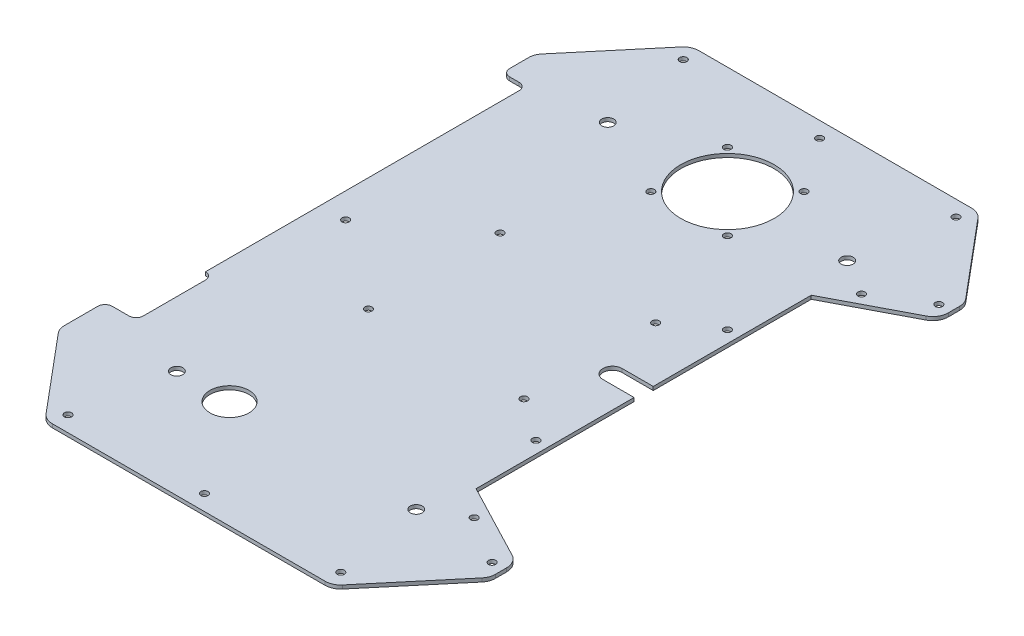
from build123d import *

# Parameters (mm, degrees)
BOSS_EXTRU_1_DEPTH           = 1.5
CHANFREIN1_SIZE              = 30
CHANFREIN1_SIZE2             = 35.752607778
ENL_V_MAT_EXTRU_1_REACH      = 164.257
ESQUISSE2_R                  = 2.5
ESQUISSE2_R_2                = 1.5
ESQUISSE5_R                  = 1.5
ENL_V_MAT_EXTRU_4_DEPTH      = 163.256741
CONG_2_R                     = 6.5
ESQUISSE3_R                  = 1.5
ENL_V_MAT_EXTRU_2_DEPTH      = 163.256741
ENL_V_MAT_EXTRU_3_DEPTH      = 163.256741
ENL_V_MAT_EXTRU_3_DEPTH_BACK = 163.256741
ESQUISSE4_R                  = 8.15
ESQUISSE4_R_2                = 19.5
ESQUISSE4_R_3                = 1.5
ENL_V_MAT_EXTRU_5_REACH      = 164.257
ESQUISSE6_W                  = 3
ESQUISSE6_H                  = 32
ESQUISSE6_R                  = 1.5
CONG_1_R                     = 3


with BuildPart() as part:
    # Esquisse1 → Boss.-Extru.1 (new body)
    with BuildSketch(Plane(origin=(0, 0, 0), x_dir=(1, 0, 0), z_dir=(0, 1, 0))):
        Polygon((-90, 135), (90, 135), (90, 88.309833424), (55, 70), (55, 0), (-90, 0), align=None)
    extrude(amount=BOSS_EXTRU_1_DEPTH)

    # Chanfrein1
    chanfrein1_edges = [part.edges().sort_by_distance(p)[0] for p in [
        (-90, 0.75, -135),
        (90, 0.75, -135),
    ]]
    chanfrein1_side = [part.faces().sort_by_distance(p)[0] for p in [
        (0, 0.75, -135),
    ]]
    chamfer(chanfrein1_edges, length=CHANFREIN1_SIZE, length2=CHANFREIN1_SIZE2, reference=chanfrein1_side[0])

    # Esquisse2 → Enlèv. mat.-Extru.1 (cut, up to next)
    with BuildSketch(Plane(origin=(0, 1.5, 0), x_dir=(1, 0, 0), z_dir=(0, 1, 0)), mode=Mode.PRIVATE) as enl_v_mat_extru_1_sk1:
        with Locations(Location((-50, 90, 0), (0, 0, 270))):
            Circle(ESQUISSE2_R)
    enl_v_mat_extru_1_tool1 = extrude(enl_v_mat_extru_1_sk1.sketch, amount=-ENL_V_MAT_EXTRU_1_REACH, mode=Mode.PRIVATE) & part.part
    # Esquisse2 → Enlèv. mat.-Extru.1 (cut, up to next)
    with BuildSketch(Plane(origin=(0, 1.5, 0), x_dir=(1, 0, 0), z_dir=(0, 1, 0)), mode=Mode.PRIVATE) as enl_v_mat_extru_1_sk2:
        with Locations(Location((50, 90, 0), (0, 0, 270))):
            Circle(ESQUISSE2_R)
    enl_v_mat_extru_1_tool2 = extrude(enl_v_mat_extru_1_sk2.sketch, amount=-ENL_V_MAT_EXTRU_1_REACH, mode=Mode.PRIVATE) & part.part
    # Esquisse2 → Enlèv. mat.-Extru.1 (cut, up to next)
    with BuildSketch(Plane(origin=(0, 1.5, 0), x_dir=(1, 0, 0), z_dir=(0, 1, 0)), mode=Mode.PRIVATE) as enl_v_mat_extru_1_sk3:
        with Locations(Location((50, 40, 0), (0, 0, 270))):
            Circle(ESQUISSE2_R_2)
    enl_v_mat_extru_1_tool3 = extrude(enl_v_mat_extru_1_sk3.sketch, amount=-ENL_V_MAT_EXTRU_1_REACH, mode=Mode.PRIVATE) & part.part
    add(enl_v_mat_extru_1_tool1.solids().sort_by_distance((-50, 1.5, -90))[0], mode=Mode.SUBTRACT)
    add(enl_v_mat_extru_1_tool2.solids().sort_by_distance((50, 1.5, -90))[0], mode=Mode.SUBTRACT)
    add(enl_v_mat_extru_1_tool3.solids().sort_by_distance((50, 1.5, -40))[0], mode=Mode.SUBTRACT)

    # Esquisse5 → Enlèv. mat.-Extru.4 (cut, through all)
    with BuildSketch(Plane(origin=(0, 1.5, 0), x_dir=(1, 0, 0), z_dir=(0, 1, 0))):
        with Locations(Location((85, 93.309833424, 0), (0, 0, 270))):
            Circle(ESQUISSE5_R)
        with Locations(Location((65.087362858, 80.91994096, 0), (0, 0, 270))):
            Circle(ESQUISSE5_R)
        with Locations(Location((-56.969000222, 128.5, 0), (0, 0, 270))):
            Circle(ESQUISSE5_R)
        with Locations(Location((0, 128.5, 0), (0, 0, 270))):
            Circle(ESQUISSE5_R)
        with Locations(Location((56.969000222, 128.5, 0), (0, 0, 270))):
            Circle(ESQUISSE5_R)
    extrude(amount=-ENL_V_MAT_EXTRU_4_DEPTH, mode=Mode.SUBTRACT)

    # Congé2
    cong_2_edges = [part.edges().sort_by_distance(p)[0] for p in [
        (90, 0.75, -88.309833424),
        (-60, 0.75, -135),
        (60, 0.75, -135),
        (90, 0.75, -99.247392222),
        (-90, 0.75, -99.247392222),
    ]]
    fillet(cong_2_edges, radius=CONG_2_R)

    # Symétrie1: part across plane


with BuildPart() as part_1:
    add(part.part)
    add(part.part.mirror(Plane(origin=(55, 1.5, 0), x_dir=(1, 0, 0), z_dir=(0, 0, -1))))

    # Esquisse3 → Enlèv. mat.-Extru.2 (cut, through all)
    with BuildSketch(Plane(origin=(0, 1.5, 0), x_dir=(1, 0, 0), z_dir=(0, 1, 0))):
        with Locations(Location((32.5, -27.5, 0), (0, 0, 270))):
            Circle(ESQUISSE3_R)
        with Locations(Location((32.5, 27.5, 0), (0, 0, 270))):
            Circle(ESQUISSE3_R)
        with Locations(Location((-32.5, -27.5, 0), (0, 0, 90))):
            Circle(ESQUISSE3_R)
        with Locations(Location((-32.5, 27.5, 0), (0, 0, 90))):
            Circle(ESQUISSE3_R)
        with BuildLine():
            Line((42, 4), (55, 4))
            ThreePointArc((55, 4), (59, 0), (55, -4))
            Line((55, -4), (42, -4))
            ThreePointArc((42, -4), (38, 0), (42, 4))
        make_face()
    extrude(amount=-ENL_V_MAT_EXTRU_2_DEPTH, mode=Mode.SUBTRACT)

    # Esquisse4 → Enlèv. mat.-Extru.3 (cut, two sides: drawn at the far end of the back side and taken through both)
    with BuildSketch(Plane(origin=(0, 1.5, 0), x_dir=(1, 0, 0), z_dir=(0, 1, 0)).offset(-ENL_V_MAT_EXTRU_3_DEPTH_BACK)):
        with Locations(Location((-28, -90, 0), (0, 0, 270))):
            Circle(ESQUISSE4_R)
        with Locations(Location((0, 90, 0), (0, 0, 270))):
            Circle(ESQUISSE4_R_2)
        with Locations(Location((16, 106, 0), (0, 0, 270))):
            Circle(ESQUISSE4_R_3)
        with Locations(Location((-16, 106, 0), (0, 0, 270))):
            Circle(ESQUISSE4_R_3)
        with Locations(Location((-16, 74, 0), (0, 0, 270))):
            Circle(ESQUISSE4_R_3)
        with Locations(Location((16, 74, 0), (0, 0, 270))):
            Circle(ESQUISSE4_R_3)
    extrude(amount=ENL_V_MAT_EXTRU_3_DEPTH + ENL_V_MAT_EXTRU_3_DEPTH_BACK, mode=Mode.SUBTRACT)

    # Esquisse6 → Enlèv. mat.-Extru.5 (cut, up to next)
    with BuildSketch(Plane(origin=(0, 1.5, 0), x_dir=(1, 0, 0), z_dir=(0, 1, 0)), mode=Mode.PRIVATE) as enl_v_mat_extru_5_sk1:
        Polygon((-90, 86), (-90, -80), (-80, -80), (-80, -48), (-80, 86), align=None)
    enl_v_mat_extru_5_tool1 = extrude(enl_v_mat_extru_5_sk1.sketch, amount=-ENL_V_MAT_EXTRU_5_REACH, mode=Mode.PRIVATE) & part_1.part
    # Esquisse6 → Enlèv. mat.-Extru.5 (cut, up to next)
    with BuildSketch(Plane(origin=(0, 1.5, 0), x_dir=(1, 0, 0), z_dir=(0, 1, 0)), mode=Mode.PRIVATE) as enl_v_mat_extru_5_sk2:
        with Locations((-78.5, -64)):
            Rectangle(ESQUISSE6_W, ESQUISSE6_H)
    enl_v_mat_extru_5_tool2 = extrude(enl_v_mat_extru_5_sk2.sketch, amount=-ENL_V_MAT_EXTRU_5_REACH, mode=Mode.PRIVATE) & part_1.part
    # Esquisse6 → Enlèv. mat.-Extru.5 (cut, up to next)
    with BuildSketch(Plane(origin=(0, 1.5, 0), x_dir=(1, 0, 0), z_dir=(0, 1, 0)), mode=Mode.PRIVATE) as enl_v_mat_extru_5_sk3:
        with Locations(Location((-69.5, 0, 0), (0, 0, 270))):
            Circle(ESQUISSE6_R)
    enl_v_mat_extru_5_tool3 = extrude(enl_v_mat_extru_5_sk3.sketch, amount=-ENL_V_MAT_EXTRU_5_REACH, mode=Mode.PRIVATE) & part_1.part
    add(enl_v_mat_extru_5_tool1.solids().sort_by_distance((-85, 1.5, -3))[0], mode=Mode.SUBTRACT)
    add(enl_v_mat_extru_5_tool2.solids().sort_by_distance((-78.5, 1.5, 64))[0], mode=Mode.SUBTRACT)
    add(enl_v_mat_extru_5_tool3.solids().sort_by_distance((-69.5, 1.5, 0))[0], mode=Mode.SUBTRACT)

    # Congé1
    cong_1_edges = [part_1.edges().sort_by_distance(p)[0] for p in [
        (-77, 0.75, 80),
        (-77, 0.75, 48),
        (-80, 0.75, -86),
        (-90, 0.75, 80),
        (-90, 0.75, -86),
    ]]
    fillet(cong_1_edges, radius=CONG_1_R - 0.0001)  # a hair under: the kernel refuses the full size


solid = part_1.part
